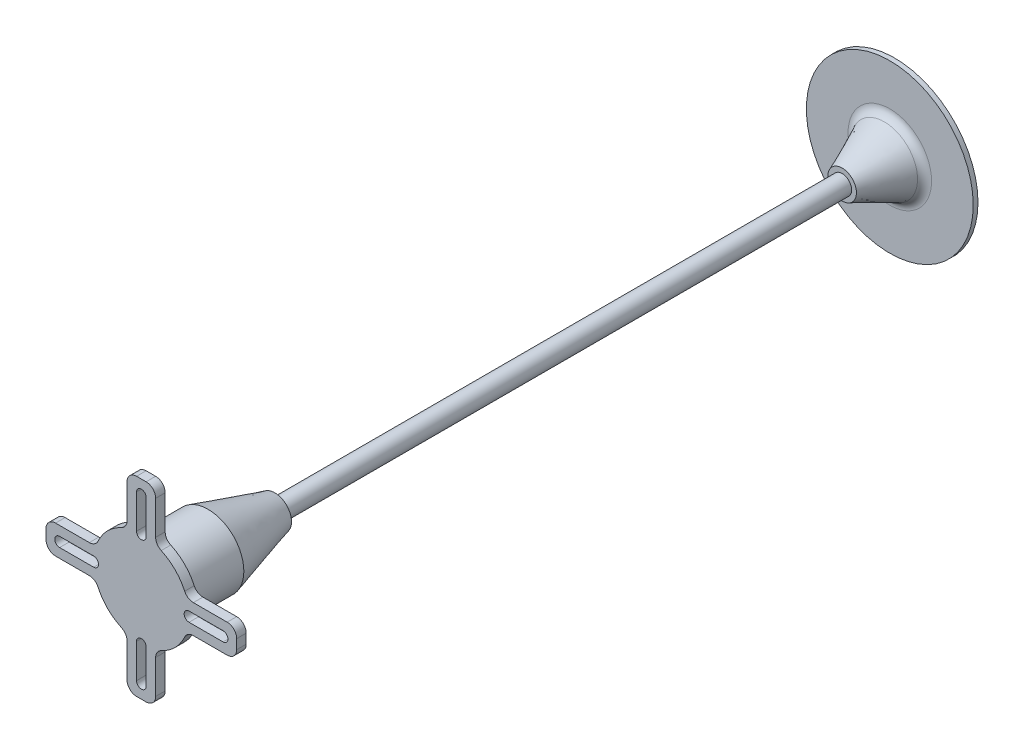
from build123d import *

# Parameters (mm, degrees)
SKETCH1_R           = 17.5
BOSS_EXTRUDE1_DEPTH = 1
SKETCH3_R           = 3
BOSS_EXTRUDE2_DEPTH = 10
FILLET1_R           = 2
SKETCH4_R           = 2
CUT_EXTRUDE1_DEPTH  = 7
BOSS_EXTRUDE3_START = 140
SKETCH5_R           = 2
BOSS_EXTRUDE3_DEPTH = 140
SKETCH6_R           = 3.5
BOSS_EXTRUDE4_DEPTH = 14
SKETCH8_R           = 7.5
BOSS_EXTRUDE5_DEPTH = 12
BOSS_EXTRUDE6_DEPTH = 2


with BuildPart() as part:
    # Sketch1 → Boss-Extrude1 (new body)
    with BuildSketch(Plane.XY):
        Circle(SKETCH1_R)
    extrude(amount=BOSS_EXTRUDE1_DEPTH)

    # Sketch3 → Boss-Extrude2 (add)
    with BuildSketch(Plane.XY.offset(1)):
        Circle(SKETCH3_R)
    extrude(amount=BOSS_EXTRUDE2_DEPTH)

    # Loft1: read off the stored shape, not the designer's step
    # Loft1: loft between two sections, ruled curve by curve
    loft1_from = [
        Edge.make_bspline([(1.044538227, -2.81228375, 11), (-4.580029274, -4.901360204, 11), (-6.669105728, 0.723207296, 11), (-1.044538227, 2.81228375, 11), (4.580029274, 4.901360204, 11), (6.669105728, -0.723207296, 11), (1.044538227, -2.81228375, 11)], [0, 0, 0, 0, 0.5, 0.5, 0.5, 1, 1, 1, 1], 3, [1, 0.333333333, 0.333333333, 1, 0.333333333, 0.333333333, 1]),
    ]
    loft1_to = [
        Edge.make_bspline([(5.441388928, -5.161519789, 1), (-4.88165065, -16.044297645, 1), (-15.764428506, -5.721258067, 1), (-5.441388928, 5.161519789, 1), (4.88165065, 16.044297645, 1), (15.764428506, 5.721258067, 1), (5.441388928, -5.161519789, 1)], [0, 0, 0, 0, 0.5, 0.5, 0.5, 1, 1, 1, 1], 3, [1, 0.333333333, 0.333333333, 1, 0.333333333, 0.333333333, 1]),
    ]
    loft1 = Solid(Shell([*[Face.make_surface_from_curves(loft1_from[k], loft1_to[k]) for k in range(1)], Face(Wire(loft1_from)), Face(Wire(loft1_to))]))
    add(loft1)

    # Fillet1
    fillet1_edges = [part.edges().sort_by_distance(p)[0] for p in [
        (-5.441388928, 5.161519789, 1),
    ]]
    fillet(fillet1_edges, radius=FILLET1_R)

    # Sketch4 → Cut-Extrude1 (cut)
    with BuildSketch(Plane.XY.offset(11)):
        Circle(SKETCH4_R)
    extrude(amount=-CUT_EXTRUDE1_DEPTH, mode=Mode.SUBTRACT)

    # Sketch5 → Boss-Extrude3 (add)
    with BuildSketch(Plane.XY.offset(4).offset(BOSS_EXTRUDE3_START)):
        Circle(SKETCH5_R)
    extrude(amount=-BOSS_EXTRUDE3_DEPTH)

    # Sketch6 → Boss-Extrude4 (add)
    with BuildSketch(Plane.XY.offset(144)):
        Circle(SKETCH6_R)
    extrude(amount=-BOSS_EXTRUDE4_DEPTH)

    # Loft2: read off the stored shape, not the designer's step
    # Loft2: loft between two sections, ruled curve by curve
    loft2_from = [
        Edge.make_bspline([(2.496146584, -7.072429019, 144), (-11.648711454, -12.064722187, 144), (-16.641004622, 2.080135851, 144), (-2.496146584, 7.072429019, 144), (11.648711454, 12.064722187, 144), (16.641004622, -2.080135851, 144), (2.496146584, -7.072429019, 144)], [0, 0, 0, 0, 0.5, 0.5, 0.5, 1, 1, 1, 1], 3, [1, 0.333333333, 0.333333333, 1, 0.333333333, 0.333333333, 1]),
    ]
    loft2_to = [
        Edge.make_bspline([(0.28118335, -3.488686848, 130), (-6.696190346, -4.051053549, 130), (-7.258557046, 2.926320147, 130), (-0.28118335, 3.488686848, 130), (6.696190346, 4.051053549, 130), (7.258557046, -2.926320147, 130), (0.28118335, -3.488686848, 130)], [0, 0, 0, 0, 0.5, 0.5, 0.5, 1, 1, 1, 1], 3, [1, 0.333333333, 0.333333333, 1, 0.333333333, 0.333333333, 1]),
    ]
    loft2 = Solid(Shell([*[Face.make_surface_from_curves(loft2_from[k], loft2_to[k]) for k in range(1)], Face(Wire(loft2_from)), Face(Wire(loft2_to))]))
    add(loft2)

    # Sketch8 → Boss-Extrude5 (add)
    with BuildSketch(Plane.XY.offset(144)):
        with Locations(Location((0, 0, 0), (0, 0, 289.44))):
            Circle(SKETCH8_R)
    extrude(amount=BOSS_EXTRUDE5_DEPTH)

    # Sketch9 → Boss-Extrude6 (add)
    with BuildSketch(Plane.XY.offset(156)):
        with BuildLine():
            Line((-18, 3), (-10.908712115, 3))
            ThreePointArc((-10.908712115, 3), (-9.828588665, 3.316749177), (-9.090593429, 4.166666667))
            ThreePointArc((-9.090593429, 4.166666667), (-7.071067812, 7.071067812), (-4.166666667, 9.090593429))
            ThreePointArc((-4.166666667, 9.090593429), (-3.316749177, 9.828588665), (-3, 10.908712115))
            Line((-3, 10.908712115), (-3, 18))
            ThreePointArc((-3, 18), (-2.414213562, 19.414213562), (-1, 20))
            Line((-1, 20), (1, 20))
            ThreePointArc((1, 20), (2.414213562, 19.414213562), (3, 18))
            Line((3, 18), (3, 10.908712115))
            ThreePointArc((3, 10.908712115), (3.316749177, 9.828588665), (4.166666667, 9.090593429))
            ThreePointArc((4.166666667, 9.090593429), (7.071067812, 7.071067812), (9.090593429, 4.166666667))
            ThreePointArc((9.090593429, 4.166666667), (9.828588665, 3.316749177), (10.908712115, 3))
            Line((10.908712115, 3), (18, 3))
            ThreePointArc((18, 3), (19.414213562, 2.414213562), (20, 1))
            Line((20, 1), (20, -1))
            ThreePointArc((20, -1), (19.414213562, -2.414213562), (18, -3))
            Line((18, -3), (10.908712115, -3))
            ThreePointArc((10.908712115, -3), (9.828588665, -3.316749177), (9.090593429, -4.166666667))
            ThreePointArc((9.090593429, -4.166666667), (7.071067812, -7.071067812), (4.166666667, -9.090593429))
            ThreePointArc((4.166666667, -9.090593429), (3.316749177, -9.828588665), (3, -10.908712115))
            Line((3, -10.908712115), (3, -18))
            ThreePointArc((3, -18), (2.414213562, -19.414213562), (1, -20))
            Line((1, -20), (-1, -20))
            ThreePointArc((-1, -20), (-2.414213562, -19.414213562), (-3, -18))
            Line((-3, -18), (-3, -10.908712115))
            ThreePointArc((-3, -10.908712115), (-3.316749177, -9.828588665), (-4.166666667, -9.090593429))
            ThreePointArc((-4.166666667, -9.090593429), (-7.071067812, -7.071067812), (-9.090593429, -4.166666667))
            ThreePointArc((-9.090593429, -4.166666667), (-9.828588665, -3.316749177), (-10.908712115, -3))
            Line((-10.908712115, -3), (-18, -3))
            ThreePointArc((-18, -3), (-19.414213562, -2.414213562), (-20, -1))
            Line((-20, -1), (-20, 1))
            ThreePointArc((-20, 1), (-19.414213562, 2.414213562), (-18, 3))
        make_face()
        with BuildLine():
            Line((-17.145168387, 1.019387686), (-10, 1.019387686))
            ThreePointArc((-10, 1.019387686), (-8.980612314, 0), (-10, -1.019387686))
            Line((-10, -1.019387686), (-17.145168387, -1.019387686))
            ThreePointArc((-17.145168387, -1.019387686), (-18.164556073, 0), (-17.145168387, 1.019387686))
        make_face(mode=Mode.SUBTRACT)
        with BuildLine():
            Line((-1.019387686, 17.145168387), (-1.019387686, 10))
            ThreePointArc((-1.019387686, 10), (0, 8.980612314), (1.019387686, 10))
            Line((1.019387686, 10), (1.019387686, 17.145168387))
            ThreePointArc((1.019387686, 17.145168387), (0, 18.164556073), (-1.019387686, 17.145168387))
        make_face(mode=Mode.SUBTRACT)
        with BuildLine():
            Line((1.019387686, -17.145168387), (1.019387686, -10))
            ThreePointArc((1.019387686, -10), (0, -8.980612314), (-1.019387686, -10))
            Line((-1.019387686, -10), (-1.019387686, -17.145168387))
            ThreePointArc((-1.019387686, -17.145168387), (0, -18.164556073), (1.019387686, -17.145168387))
        make_face(mode=Mode.SUBTRACT)
        with BuildLine():
            Line((17.145168387, -1.019387686), (10, -1.019387686))
            ThreePointArc((10, -1.019387686), (8.980612314, 0), (10, 1.019387686))
            Line((10, 1.019387686), (17.145168387, 1.019387686))
            ThreePointArc((17.145168387, 1.019387686), (18.164556073, 0), (17.145168387, -1.019387686))
        make_face(mode=Mode.SUBTRACT)
    extrude(amount=BOSS_EXTRUDE6_DEPTH)


solid = part.part
